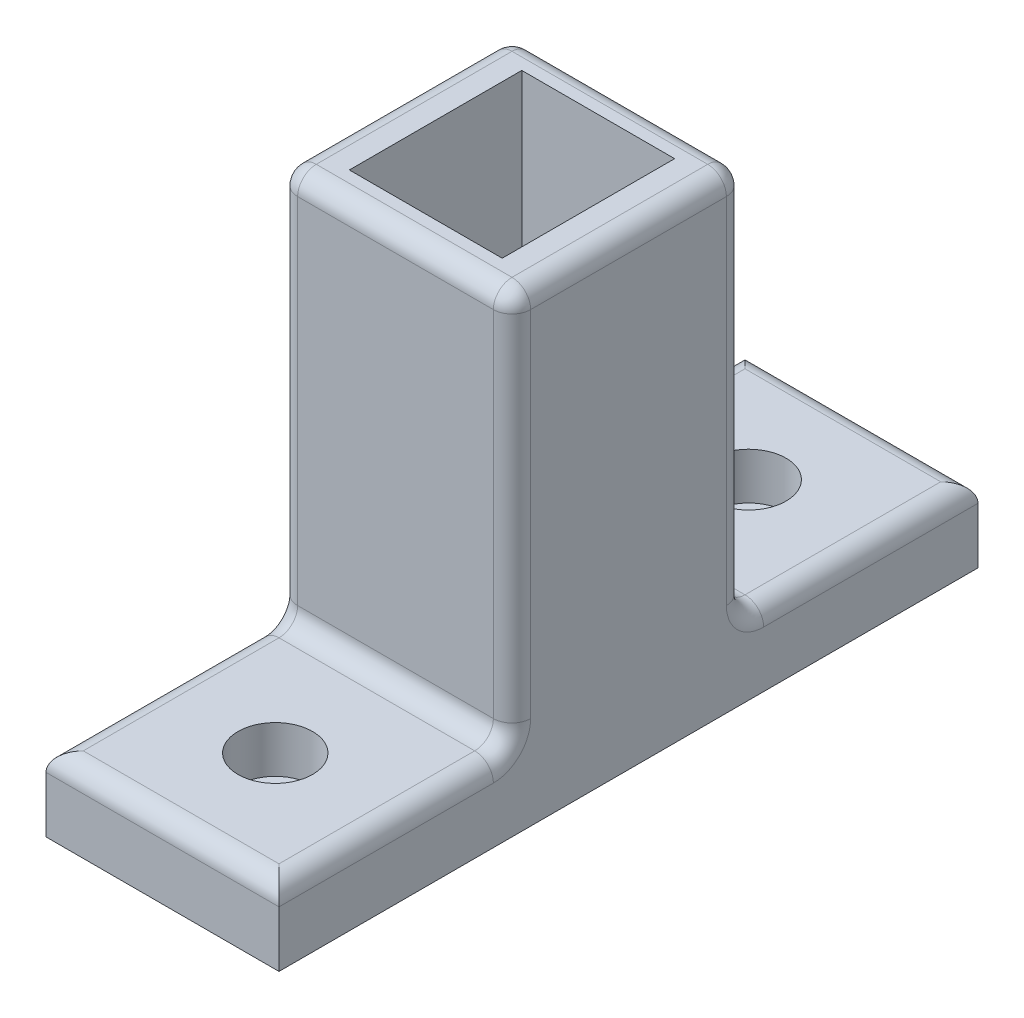
from build123d import *

# Parameters (mm, degrees)
SKETCH1_W               = 25
SKETCH1_H               = 25
SKETCH1_W_2             = 16.4
SKETCH1_H_2             = 18.5
BOSS_EXTRUDE1_DEPTH     = 50
SKETCH6_W               = 25
SKETCH6_H               = 75
BOSS_EXTRUDE3_DEPTH     = 8
FILLET2_R               = 2
SKETCH7_R               = 4
CUT_EXTRUDE1_DEPTH      = 5
CUT_EXTRUDE4_DEPTH      = 64.73774392
CUT_EXTRUDE4_DEPTH_BACK = 64.73774392
SKETCH8_R               = 2.38125


with BuildPart() as part:
    # Sketch1 → Boss-Extrude1 (new body)
    with BuildSketch(Plane(origin=(0, 0, 0), x_dir=(1, 0, 0), z_dir=(0, 1, 0))):
        Rectangle(SKETCH1_W, SKETCH1_H)
        Rectangle(SKETCH1_W_2, SKETCH1_H_2, mode=Mode.SUBTRACT)
    extrude(amount=BOSS_EXTRUDE1_DEPTH)

    # Sketch6 → Boss-Extrude3 (add)
    with BuildSketch(Plane(origin=(0, 0, 0), x_dir=(1, 0, 0), z_dir=(0, 1, 0))):
        Rectangle(SKETCH6_W, SKETCH6_H)
    extrude(amount=BOSS_EXTRUDE3_DEPTH)

    # Fillet2
    fillet2_edges = [part.edges().sort_by_distance(p)[0] for p in [
        (0, 8, -12.5),
        (0, 50, -12.5),
        (12.5, 29, -12.5),
        (12.5, 50, 0),
        (12.5, 29, 12.5),
        (-12.5, 29, 12.5),
        (0, 50, 12.5),
        (-12.5, 29, -12.5),
        (-12.5, 50, 0),
        (-12.5, 8, -25),
        (12.5, 8, -25),
        (0, 8, -37.5),
        (0, 8, 37.5),
        (-12.5, 8, 25),
        (0, 8, 12.5),
        (12.5, 8, 25),
    ]]
    fillet(fillet2_edges, radius=FILLET2_R)

    # Sketch7 → Cut-Extrude1 (cut)
    with BuildSketch(Plane(origin=(0, 8, 0), x_dir=(1, 0, 0), z_dir=(0, 1, 0))):
        Circle(SKETCH7_R)
        with Locations((0, 25.4)):
            Circle(SKETCH7_R)
        with Locations((0, -25.4)):
            Circle(SKETCH7_R)
    extrude(amount=-CUT_EXTRUDE1_DEPTH, mode=Mode.SUBTRACT)

    # Sketch8 → Cut-Extrude4 (cut, two sides: drawn at the far end of the back side and taken through both)
    with BuildSketch(Plane(origin=(0, 0, 0), x_dir=(1, 0, 0), z_dir=(0, 1, 0)).offset(-CUT_EXTRUDE4_DEPTH_BACK)):
        Circle(SKETCH8_R)
        with Locations((0, 25.4)):
            Circle(SKETCH8_R)
        with Locations((0, -25.4)):
            Circle(SKETCH8_R)
    extrude(amount=CUT_EXTRUDE4_DEPTH + CUT_EXTRUDE4_DEPTH_BACK, mode=Mode.SUBTRACT)


solid = part.part
